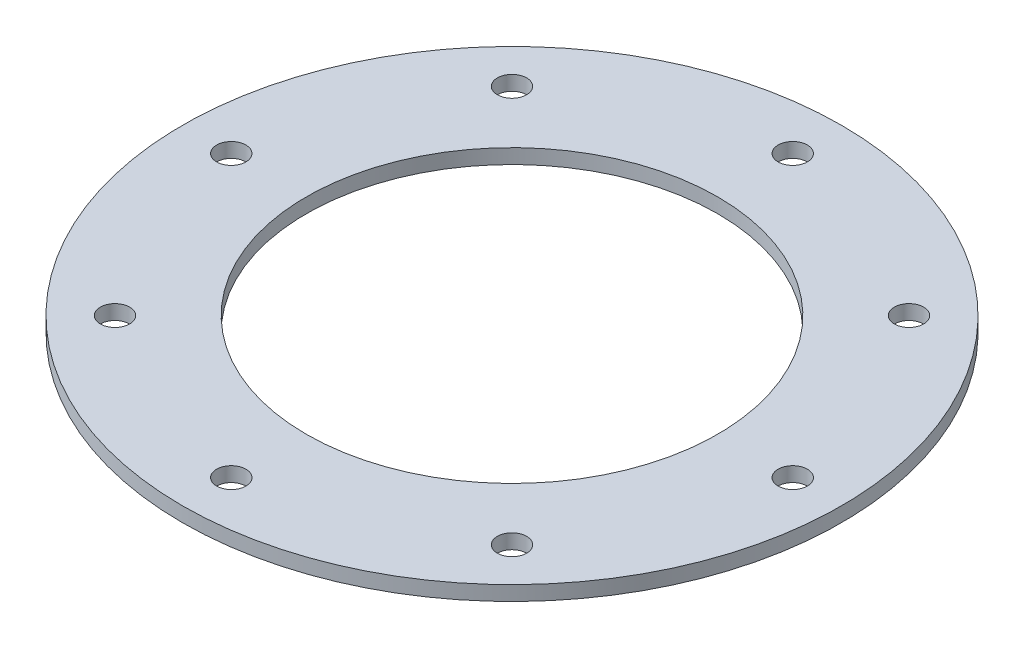
from build123d import *

# Parameters (mm, degrees)
SKETCH1_R           = 135
SKETCH1_R_2         = 84.25
BOSS_EXTRUDE1_DEPTH = 6
SKETCH2_R           = 6
CUT_EXTRUDE1_DEPTH  = 192.013088557


with BuildPart() as part:
    # Sketch1 → Boss-Extrude1 (new body)
    with BuildSketch(Plane(origin=(0, 0, 0), x_dir=(1, 0, 0), z_dir=(0, 1, 0))):
        Circle(SKETCH1_R)
        Circle(SKETCH1_R_2, mode=Mode.SUBTRACT)
    extrude(amount=BOSS_EXTRUDE1_DEPTH)

    # Sketch2 → Cut-Extrude1 (cut, through all)
    with BuildSketch(Plane(origin=(0, 6, 0), x_dir=(1, 0, 0), z_dir=(0, 1, 0))):
        with Locations((0, 115)):
            Circle(SKETCH2_R)
        with Locations((81.317279836, 81.317279836)):
            Circle(SKETCH2_R)
        with Locations((115, 0)):
            Circle(SKETCH2_R)
        with Locations((81.317279836, -81.317279836)):
            Circle(SKETCH2_R)
        with Locations((0, -115)):
            Circle(SKETCH2_R)
        with Locations((-81.317279836, -81.317279836)):
            Circle(SKETCH2_R)
        with Locations((-115, 0)):
            Circle(SKETCH2_R)
        with Locations((-81.317279836, 81.317279836)):
            Circle(SKETCH2_R)
    extrude(amount=-CUT_EXTRUDE1_DEPTH, mode=Mode.SUBTRACT)


solid = part.part
